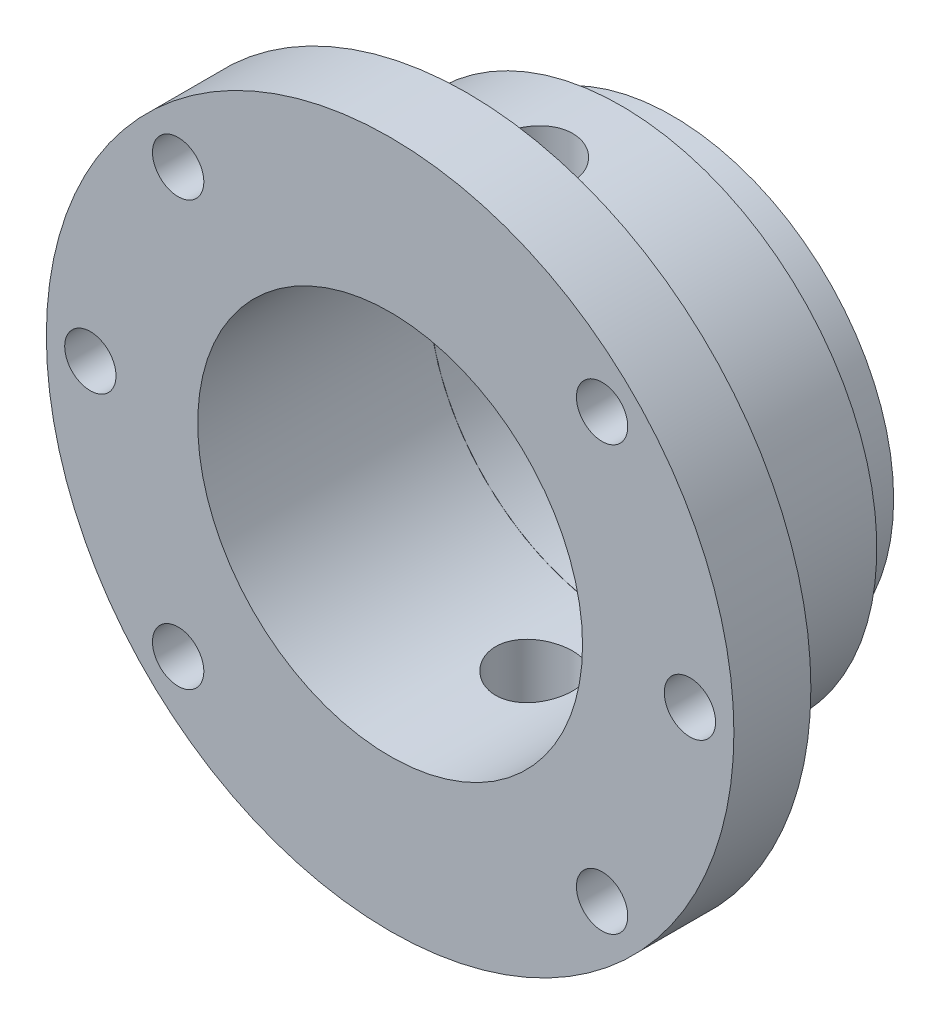
from build123d import *

# Parameters (mm, degrees)
SKETCH_1_R          = 26.8
SKETCH_1_R_2        = 15
EXTRUDE_1_DEPTH     = 18
SKETCH_2_R          = 17.253
SKETCH_2_R_2        = 14.981500248
EXTRUDE_2_DEPTH     = 4
SKETCH_3_R          = 26.8
SKETCH_3_R_2        = 19.94
CUT_EXTRUDE_3_DEPTH = 12
SKETCH_5_R          = 2
CUT_EXTRUDE_4_DEPTH = 42.139761788
SKETCH_7_R          = 3
CUT_EXTRUDE_8_DEPTH = 100


with BuildPart() as part:
    # Эскиз1 → Вытянуть1 (new body)
    with BuildSketch(Plane.XY):
        Circle(SKETCH_1_R)
        Circle(SKETCH_1_R_2, mode=Mode.SUBTRACT)
    extrude(amount=EXTRUDE_1_DEPTH)

    # Эскиз2 → Вытянуть2 (add)
    with BuildSketch(Plane(origin=(0, 0, 0), x_dir=(-1, 0, 0), z_dir=(0, 0, -1))):
        Circle(SKETCH_2_R)
        Circle(SKETCH_2_R_2, mode=Mode.SUBTRACT)
    extrude(amount=EXTRUDE_2_DEPTH)

    # Эскиз3 → Вытянуть3 (cut)
    with BuildSketch(Plane(origin=(0, 0, 0), x_dir=(-1, 0, 0), z_dir=(0, 0, -1))):
        Circle(SKETCH_3_R)
        Circle(SKETCH_3_R_2, mode=Mode.SUBTRACT)
    extrude(amount=-CUT_EXTRUDE_3_DEPTH, mode=Mode.SUBTRACT)

    # Эскиз5 → Вытянуть4 (cut, through all)
    with BuildSketch(Plane(origin=(0, 0, 12), x_dir=(-1, 0, 0), z_dir=(0, 0, -1))):
        with Locations((-23.37, 0)):
            Circle(SKETCH_5_R)
        with Locations((-16.525085476, 16.525085476)):
            Circle(SKETCH_5_R)
        with Locations((16.525085476, 16.525085476)):
            Circle(SKETCH_5_R)
        with Locations((23.37, 0)):
            Circle(SKETCH_5_R)
        with Locations((16.525085476, -16.525085476)):
            Circle(SKETCH_5_R)
        with Locations((-16.525085476, -16.525085476)):
            Circle(SKETCH_5_R)
    extrude(amount=-CUT_EXTRUDE_4_DEPTH, mode=Mode.SUBTRACT)

    # Эскиз7 → Вытянуть8 (cut)
    with BuildSketch(Plane(origin=(0, 29.05014473, 12), x_dir=(1, 0, 0), z_dir=(0, -1, 0))):
        with Locations((0, -5.233499887)):
            Circle(SKETCH_7_R)
    extrude(amount=CUT_EXTRUDE_8_DEPTH, mode=Mode.SUBTRACT)


solid = part.part
